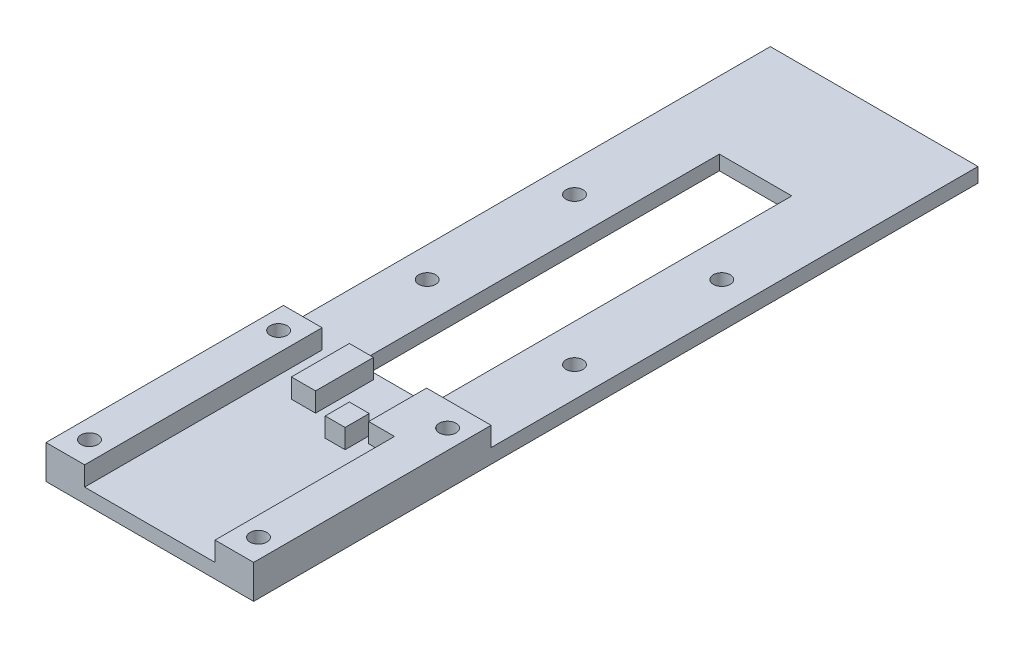
from build123d import *

# Parameters (mm, degrees)
SKETCH1_W           = 43
SKETCH1_H           = 150
BOSS_EXTRUDE1_DEPTH = 3
SKETCH2_R           = 1.75
CUT_EXTRUDE1_DEPTH  = 10
SKETCH3_W           = 15
SKETCH3_H           = 75
CUT_EXTRUDE2_DEPTH  = 10
SKETCH4_W           = 5
SKETCH4_H           = 12
SKETCH4_W_2         = 4.116849784
SKETCH4_H_2         = 1.5
SKETCH4_H_3         = 3.5
BOSS_EXTRUDE2_DEPTH = 4
SKETCH5_W           = 8
SKETCH5_H           = 49.17
BOSS_EXTRUDE3_DEPTH = 4
SKETCH7_W           = 0.35
SKETCH7_H           = 12
BOSS_EXTRUDE4_DEPTH = 4
SKETCH8_R           = 1.75
CUT_EXTRUDE3_DEPTH  = 79.334219853


with BuildPart() as part:
    # Sketch1 → Boss-Extrude1 (new body)
    with BuildSketch(Plane(origin=(0, 0, 0), x_dir=(1, 0, 0), z_dir=(0, 1, 0))):
        Rectangle(SKETCH1_W, SKETCH1_H)
    extrude(amount=BOSS_EXTRUDE1_DEPTH)

    # Sketch2 → Cut-Extrude1 (cut)
    with BuildSketch(Plane(origin=(0, 3, 0), x_dir=(1, 0, 0), z_dir=(0, 1, 0))):
        with Locations((15.25, 28.19)):
            Circle(SKETCH2_R)
        with Locations((-15.25, 28.19)):
            Circle(SKETCH2_R)
        with Locations((-15.25, -2.31)):
            Circle(SKETCH2_R)
        with Locations((15.25, -2.31)):
            Circle(SKETCH2_R)
    extrude(amount=-CUT_EXTRUDE1_DEPTH, mode=Mode.SUBTRACT)

    # Sketch3 → Cut-Extrude2 (cut)
    with BuildSketch(Plane(origin=(0, 3, 0), x_dir=(1, 0, 0), z_dir=(0, 1, 0))):
        with Locations((0, 12.94)):
            Rectangle(SKETCH3_W, SKETCH3_H)
    extrude(amount=-CUT_EXTRUDE2_DEPTH, mode=Mode.SUBTRACT)

    # Sketch4 → Boss-Extrude2 (add)
    with BuildSketch(Plane(origin=(0, 3, 0), x_dir=(1, 0, 0), z_dir=(0, 1, 0))):
        with Locations((-5.35, -31.83)):
            Rectangle(SKETCH4_W, SKETCH4_H)
        with Locations((10.65, -31.83)):
            Rectangle(SKETCH4_W, SKETCH4_H)
        with Locations((4.708424892, -37.08)):
            Rectangle(SKETCH4_W_2, SKETCH4_H_2)
        with Locations((4.708424892, -39.58)):
            Rectangle(SKETCH4_W_2, SKETCH4_H_3)
    extrude(amount=BOSS_EXTRUDE2_DEPTH)

    # Sketch5 → Boss-Extrude3 (add)
    with BuildSketch(Plane(origin=(0, 3, 0), x_dir=(1, 0, 0), z_dir=(0, 1, 0))):
        with Locations((-17.5, -50.415)):
            Rectangle(SKETCH5_W, SKETCH5_H)
        with Locations((17.5, -50.415)):
            Rectangle(SKETCH5_W, SKETCH5_H)
    extrude(amount=BOSS_EXTRUDE3_DEPTH)

    # Sketch7 → Boss-Extrude4 (add)
    with BuildSketch(Plane(origin=(0, 3, 0), x_dir=(1, 0, 0), z_dir=(0, 1, 0))):
        with Locations((13.325, -31.83)):
            Rectangle(SKETCH7_W, SKETCH7_H)
    extrude(amount=BOSS_EXTRUDE4_DEPTH)

    # Sketch8 → Cut-Extrude3 (cut, through all)
    with BuildSketch(Plane(origin=(0, 7, 0), x_dir=(1, 0, 0), z_dir=(0, 1, 0))):
        with Locations((17.5, -70)):
            Circle(SKETCH8_R)
        with Locations((17.5, -30.83)):
            Circle(SKETCH8_R)
        with Locations((-17.5, -70)):
            Circle(SKETCH8_R)
        with Locations((-17.5, -30.83)):
            Circle(SKETCH8_R)
    extrude(amount=-CUT_EXTRUDE3_DEPTH, mode=Mode.SUBTRACT)


solid = part.part
